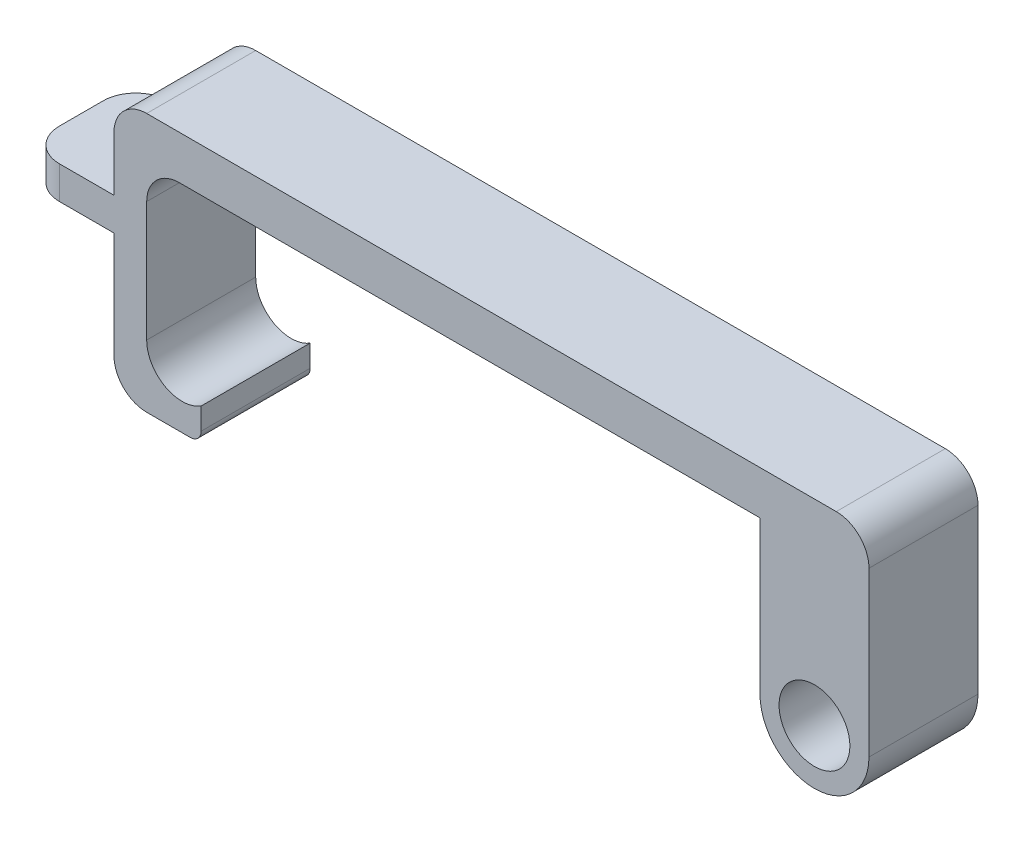
from build123d import *

# Parameters (mm, degrees)
ESQUISSE1_R        = 3.25
BOSS_EXTRU_1_DEPTH = 10
CONG_1_R           = 3
CONG_2_R           = 1


with BuildPart() as part:
    # Esquisse1 → Boss.-Extru.1 (new body)
    with BuildSketch(Plane.XY):
        with BuildLine():
            Line((11.588403104, 12.910210832), (11.588403104, 26.910210832))
            Line((11.588403104, 26.910210832), (-44.661596896, 26.910210832))
            Line((-44.661596896, 26.910210832), (-44.661596896, 12.910210832))
            ThreePointArc((-44.661596896, 12.910210832), (-42.972846395, 10.059772269), (-39.661596896, 10.171598045))
            Line((-39.661596896, 10.171598045), (-39.661596896, 7.171598045))
            Line((-39.661596896, 7.171598045), (-47.661596896, 7.171598045))
            Line((-47.661596896, 7.171598045), (-47.661596896, 19.910210832))
            Line((-47.661596896, 19.910210832), (-55.661596896, 19.910210832))
            Line((-55.661596896, 19.910210832), (-55.661596896, 22.910210832))
            Line((-55.661596896, 22.910210832), (-47.661596896, 22.910210832))
            Line((-47.661596896, 22.910210832), (-47.661596896, 30.910210832))
            Line((-47.661596896, 30.910210832), (21.588403104, 30.910210832))
            Line((21.588403104, 30.910210832), (21.588403104, 12.910210832))
            ThreePointArc((21.588403104, 12.910210832), (16.588403104, 7.910210832), (11.588403104, 12.910210832))
        make_face()
        with Locations((16.588403104, 12.910210832)):
            Circle(ESQUISSE1_R, mode=Mode.SUBTRACT)
    extrude(amount=BOSS_EXTRU_1_DEPTH)

    # Congé1
    cong_1_edges = [part.edges().sort_by_distance(p)[0] for p in [
        (-44.661596896, 26.910210832, 5),
        (-47.661596896, 7.171598045, 5),
        (21.588403104, 30.910210832, 5),
        (-47.661596896, 30.910210832, 5),
        (-55.661596896, 21.410210832, 10),
        (-55.661596896, 21.410210832, 0),
    ]]
    fillet(cong_1_edges, radius=CONG_1_R)

    # Congé2
    cong_2_edges = [part.edges().sort_by_distance(p)[0] for p in [
        (-39.661596896, 7.171598045, 5),
    ]]
    fillet(cong_2_edges, radius=CONG_2_R)


solid = part.part
